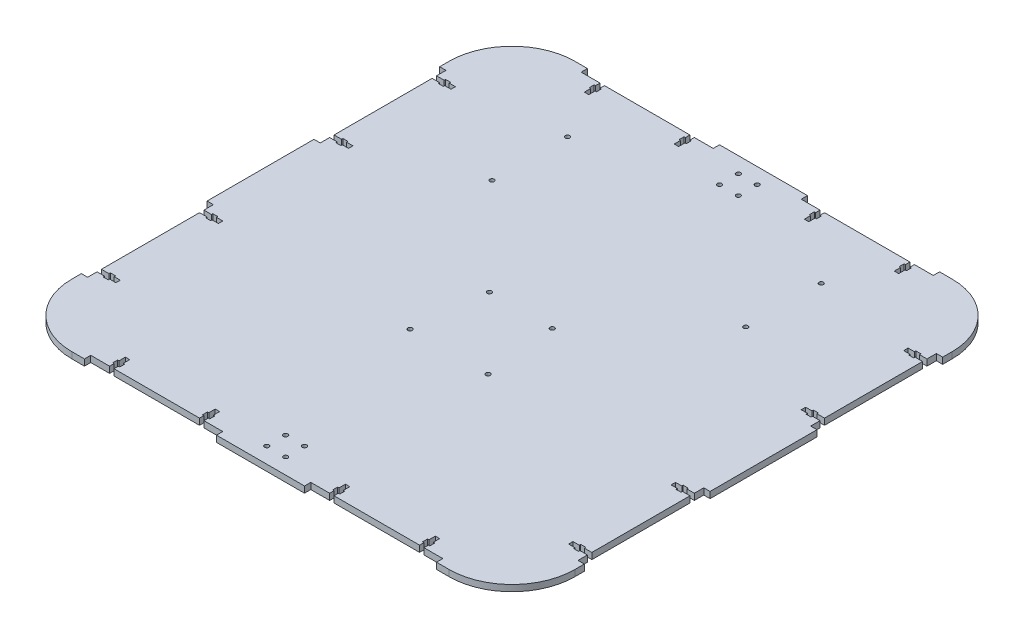
from build123d import *

# Parameters (mm, degrees)
SKETCH1_W           = 400
SKETCH1_H           = 400
SKETCH1_R           = 1.75
BOSS_EXTRUDE2_DEPTH = 5
FILLET1_R           = 50
CUT_EXTRUDE8_DEPTH  = 10
SKETCH11_W          = 105
SKETCH11_H          = 5
CUT_EXTRUDE9_DEPTH  = 10
CUT_EXTRUDE10_DEPTH = 5
SKETCH13_W          = 5
SKETCH13_H          = 100
CUT_EXTRUDE11_DEPTH = 5
SKETCH14_R          = 1.75
CUT_EXTRUDE12_DEPTH = 10
SKETCH15_R          = 1.75
CUT_EXTRUDE13_DEPTH = 10


with BuildPart() as part:
    # Sketch1 → Boss-Extrude2 (new body)
    with BuildSketch(Plane(origin=(0, 0, 0), x_dir=(1, 0, 0), z_dir=(0, 1, 0))):
        Rectangle(SKETCH1_W, SKETCH1_H)
        with Locations((-7.5, 172.5)):
            Circle(SKETCH1_R, mode=Mode.SUBTRACT)
        with Locations((-7.5, 187.5)):
            Circle(SKETCH1_R, mode=Mode.SUBTRACT)
        with Locations((7.5, 172.5)):
            Circle(SKETCH1_R, mode=Mode.SUBTRACT)
        with Locations((7.5, 187.5)):
            Circle(SKETCH1_R, mode=Mode.SUBTRACT)
        with Locations((-7.5, -187.5)):
            Circle(SKETCH1_R, mode=Mode.SUBTRACT)
        with Locations((-7.5, -172.5)):
            Circle(SKETCH1_R, mode=Mode.SUBTRACT)
        with Locations((7.5, -187.5)):
            Circle(SKETCH1_R, mode=Mode.SUBTRACT)
        with Locations((7.5, -172.5)):
            Circle(SKETCH1_R, mode=Mode.SUBTRACT)
    extrude(amount=BOSS_EXTRUDE2_DEPTH)

    # Fillet1
    fillet1_edges = [part.edges().sort_by_distance(p)[0] for p in [
        (200, 2.5, -200),
        (200, 2.5, 200),
        (-200, 2.5, 200),
        (-200, 2.5, -200),
    ]]
    fillet(fillet1_edges, radius=FILLET1_R)

    # Sketch10 → Cut-Extrude8 (cut)
    with BuildSketch(Plane(origin=(0, 5, 0), x_dir=(1, 0, 0), z_dir=(0, 1, 0))):
        Polygon((-125, -200), (-121.5, -200), (-121.5, -191.5), (-120.4, -191.5), (-120.4, -187.5), (-121.5, -187.5), (-121.5, -182.5), (-125, -182.5), (-125, -187.5), (-126.1, -187.5), (-126.1, -191.5), (-125, -191.5), align=None)
        Polygon((-53.5, -200), (-50, -200), (-50, -191.5), (-48.9, -191.5), (-48.9, -187.5), (-50, -187.5), (-50, -182.5), (-53.5, -182.5), (-53.5, -187.5), (-54.6, -187.5), (-54.6, -191.5), (-53.5, -191.5), align=None)
        Polygon((125, -200), (125, -191.5), (126.1, -191.5), (126.1, -187.5), (125, -187.5), (125, -182.5), (121.5, -182.5), (121.5, -187.5), (120.4, -187.5), (120.4, -191.5), (121.5, -191.5), (121.5, -200), align=None)
        Polygon((53.5, -200), (53.5, -191.5), (54.6, -191.5), (54.6, -187.5), (53.5, -187.5), (53.5, -182.5), (50, -182.5), (50, -187.5), (48.9, -187.5), (48.9, -191.5), (50, -191.5), (50, -200), align=None)
        Polygon((125, 200), (121.5, 200), (121.5, 191.5), (120.4, 191.5), (120.4, 187.5), (121.5, 187.5), (121.5, 182.5), (125, 182.5), (125, 187.5), (126.1, 187.5), (126.1, 191.5), (125, 191.5), align=None)
        Polygon((53.5, 200), (50, 200), (50, 191.5), (48.9, 191.5), (48.9, 187.5), (50, 187.5), (50, 182.5), (53.5, 182.5), (53.5, 187.5), (54.6, 187.5), (54.6, 191.5), (53.5, 191.5), align=None)
        Polygon((-53.5, 200), (-53.5, 191.5), (-54.6, 191.5), (-54.6, 187.5), (-53.5, 187.5), (-53.5, 182.5), (-50, 182.5), (-50, 187.5), (-48.9, 187.5), (-48.9, 191.5), (-50, 191.5), (-50, 200), align=None)
        Polygon((-125, 200), (-125, 191.5), (-126.1, 191.5), (-126.1, 187.5), (-125, 187.5), (-125, 182.5), (-121.5, 182.5), (-121.5, 187.5), (-120.4, 187.5), (-120.4, 191.5), (-121.5, 191.5), (-121.5, 200), align=None)
    extrude(amount=-CUT_EXTRUDE8_DEPTH, mode=Mode.SUBTRACT)

    # Sketch11 → Cut-Extrude9 (cut)
    with BuildSketch(Plane(origin=(0, 5, 0), x_dir=(1, 0, 0), z_dir=(0, 1, 0))):
        with Locations((-87.5, -197.5)):
            Rectangle(SKETCH11_W, SKETCH11_H)
        with Locations((87.5, -197.5)):
            Rectangle(SKETCH11_W, SKETCH11_H)
        with Locations((87.5, 197.5)):
            Rectangle(SKETCH11_W, SKETCH11_H)
        with Locations((-87.5, 197.5)):
            Rectangle(SKETCH11_W, SKETCH11_H)
    extrude(amount=-CUT_EXTRUDE9_DEPTH, mode=Mode.SUBTRACT)

    # Sketch12 → Cut-Extrude10 (cut)
    with BuildSketch(Plane(origin=(0, 5, 0), x_dir=(1, 0, 0), z_dir=(0, 1, 0))):
        Polygon((-200, 135), (-189, 135), (-189, 136.1), (-185, 136.1), (-185, 135), (-180, 135), (-180, 131.5), (-185, 131.5), (-185, 130.4), (-189, 130.4), (-189, 131.5), (-200, 131.5), align=None)
        Polygon((-200, 53.5), (-189, 53.5), (-189, 54.6), (-185, 54.6), (-185, 53.5), (-180, 53.5), (-180, 50), (-185, 50), (-185, 48.9), (-189, 48.9), (-189, 50), (-200, 50), align=None)
        Polygon((-200, -53.5), (-200, -50), (-189, -50), (-189, -48.9), (-185, -48.9), (-185, -50), (-180, -50), (-180, -53.5), (-185, -53.5), (-185, -54.6), (-189, -54.6), (-189, -53.5), align=None)
        Polygon((-200, -135), (-200, -131.5), (-189, -131.5), (-189, -130.4), (-185, -130.4), (-185, -131.5), (-180, -131.5), (-180, -135), (-185, -135), (-185, -136.1), (-189, -136.1), (-189, -135), align=None)
        Polygon((200, -135), (189, -135), (189, -136.1), (185, -136.1), (185, -135), (180, -135), (180, -131.5), (185, -131.5), (185, -130.4), (189, -130.4), (189, -131.5), (200, -131.5), align=None)
        Polygon((200, -53.5), (189, -53.5), (189, -54.6), (185, -54.6), (185, -53.5), (180, -53.5), (180, -50), (185, -50), (185, -48.9), (189, -48.9), (189, -50), (200, -50), align=None)
        Polygon((200, 53.5), (200, 50), (189, 50), (189, 48.9), (185, 48.9), (185, 50), (180, 50), (180, 53.5), (185, 53.5), (185, 54.6), (189, 54.6), (189, 53.5), align=None)
        Polygon((200, 135), (200, 131.5), (189, 131.5), (189, 130.4), (185, 130.4), (185, 131.5), (180, 131.5), (180, 135), (185, 135), (185, 136.1), (189, 136.1), (189, 135), align=None)
    extrude(amount=-CUT_EXTRUDE10_DEPTH, mode=Mode.SUBTRACT)

    # Sketch13 → Cut-Extrude11 (cut)
    with BuildSketch(Plane(origin=(0, 5, 0), x_dir=(1, 0, 0), z_dir=(0, 1, 0))):
        with Locations((-197.5, 92.5)):
            Rectangle(SKETCH13_W, SKETCH13_H)
        with Locations((-197.5, -92.5)):
            Rectangle(SKETCH13_W, SKETCH13_H)
        with Locations((197.5, -92.5)):
            Rectangle(SKETCH13_W, SKETCH13_H)
        with Locations((197.5, 92.5)):
            Rectangle(SKETCH13_W, SKETCH13_H)
    extrude(amount=-CUT_EXTRUDE11_DEPTH, mode=Mode.SUBTRACT)

    # Sketch14 → Cut-Extrude12 (cut)
    with BuildSketch(Plane(origin=(0, 5, 0), x_dir=(1, 0, 0), z_dir=(0, 1, 0))):
        with Locations((-31, -50)):
            Circle(SKETCH14_R)
        with Locations((31, -50)):
            Circle(SKETCH14_R)
        with Locations((-25, 7)):
            Circle(SKETCH14_R)
        with Locations((25, 7)):
            Circle(SKETCH14_R)
    extrude(amount=-CUT_EXTRUDE12_DEPTH, mode=Mode.SUBTRACT)

    # Sketch15 → Cut-Extrude13 (cut)
    with BuildSketch(Plane(origin=(0, 5, 0), x_dir=(1, 0, 0), z_dir=(0, 1, 0))):
        with Locations((-100.9, 145)):
            Circle(SKETCH15_R)
        with Locations((-100.9, 85)):
            Circle(SKETCH15_R)
        with Locations((100.9, 85)):
            Circle(SKETCH15_R)
        with Locations((100.9, 145)):
            Circle(SKETCH15_R)
    extrude(amount=-CUT_EXTRUDE13_DEPTH, mode=Mode.SUBTRACT)


solid = part.part
